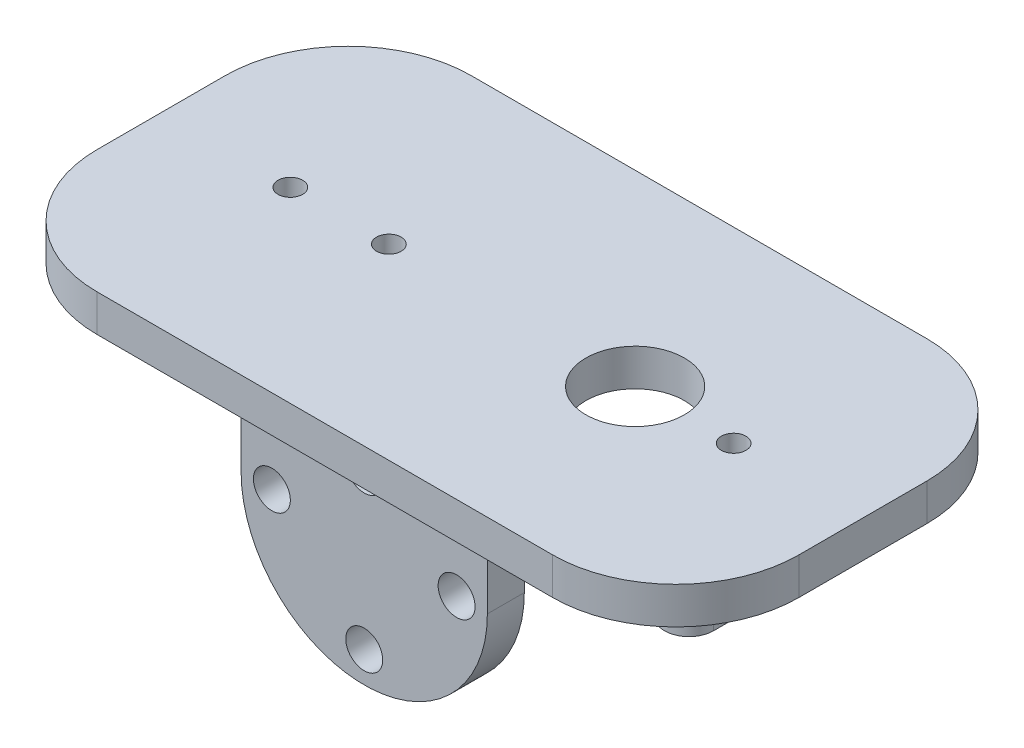
from build123d import *

# Parameters (mm, degrees)
SKETCH1_W                    = 57
SKETCH1_H                    = 30.4
BOSS_EXTRUDE1_DEPTH          = 3
BOSS_EXTRUDE2_DEPTH          = 7
BOSS_EXTRUDE3_DEPTH          = 3
BOSS_EXTRUDE4_DEPTH          = 7
F_8_0_8_DIAMETER_HOLE1_D     = 8
F_2_0_2_DIAMETER_HOLE1_D     = 2
F_2_0_2_DIAMETER_HOLE2_D     = 2
F_2_0_2_DIAMETER_HOLE2_DEPTH = 3
F_3_0_3_DIAMETER_HOLE1_D     = 3
F_3_0_3_DIAMETER_HOLE1_DEPTH = 6.2
F_3_0_3_DIAMETER_HOLE2_D     = 3
F_3_0_3_DIAMETER_HOLE2_DEPTH = 30.4
F_2_0_2_DIAMETER_HOLE3_D     = 2
F_2_0_2_DIAMETER_HOLE3_DEPTH = 5
FILLET1_R                    = 10


with BuildPart() as part:
    # Sketch1 → Boss-Extrude1 (new body)
    with BuildSketch(Plane.XZ):
        Rectangle(SKETCH1_W, SKETCH1_H)
    extrude(amount=-BOSS_EXTRUDE1_DEPTH)

    # Sketch2 → Boss-Extrude2 (add)
    with BuildSketch(Plane.XZ):
        with BuildLine():
            Line((16.37363234, -4), (16.37363234, 4))
            ThreePointArc((16.37363234, 4), (18.37363234, 6), (20.37363234, 4))
            Line((20.37363234, 4), (20.37363234, -4))
            ThreePointArc((20.37363234, -4), (18.37363234, -6), (16.37363234, -4))
        make_face()
    extrude(amount=BOSS_EXTRUDE2_DEPTH)

    # Sketch3 → Boss-Extrude3 (add)
    with BuildSketch(Plane.XY.offset(12)):
        with BuildLine():
            Line((10, -7), (10, 0))
            Line((10, 0), (-10, 0))
            Line((-10, 0), (-10, -7))
            ThreePointArc((-10, -7), (0, -17), (10, -7))
        make_face()
    extrude(amount=-BOSS_EXTRUDE3_DEPTH)

    # Sketch4 → Boss-Extrude4 (add)
    with BuildSketch(Plane.XZ):
        with BuildLine():
            Line((-11.12636766, -4), (-11.12636766, 4))
            ThreePointArc((-11.12636766, 4), (-9.12636766, 6), (-7.12636766, 4))
            Line((-7.12636766, 4), (-7.12636766, -4))
            ThreePointArc((-7.12636766, -4), (-9.12636766, -6), (-11.12636766, -4))
        make_face()
    extrude(amount=BOSS_EXTRUDE4_DEPTH)

    # Ø8.0 (8) Diameter Hole1 (through all)
    with Locations(Plane(origin=(0, 0, 0), x_dir=(-1, 0, 0), z_dir=(0, -1, 0))):
        with Locations((-10, 0)):
            Hole(F_8_0_8_DIAMETER_HOLE1_D / 2)

    # Ø2.0 (2) Diameter Hole1 (through all)
    with Locations(Plane(origin=(0, 0, 0), x_dir=(-1, 0, 0), z_dir=(0, -1, 0))):
        with Locations((18, 0)):
            Hole(F_2_0_2_DIAMETER_HOLE1_D / 2)

    # Ø2.0 (2) Diameter Hole2
    with Locations(Plane(origin=(0, 3, 0), x_dir=(1, 0, 0), z_dir=(0, 1, 0))):
        with Locations((18, 0), (-10, 0)):
            Hole(F_2_0_2_DIAMETER_HOLE2_D / 2, depth=F_2_0_2_DIAMETER_HOLE2_DEPTH)

    # Ø3.0 (3) Diameter Hole1
    with Locations(Plane.XY.offset(15.2)):
        with Locations((-7.5, -7)):
            Hole(F_3_0_3_DIAMETER_HOLE1_D / 2, depth=F_3_0_3_DIAMETER_HOLE1_DEPTH)

    # Ø3.0 (3) Diameter Hole2
    with Locations(Plane.XY.offset(15.2)):
        with Locations((0, -2), (7.5, -7), (0, -14.5)):
            Hole(F_3_0_3_DIAMETER_HOLE2_D / 2, depth=F_3_0_3_DIAMETER_HOLE2_DEPTH)

    # Ø2.0 (2) Diameter Hole3
    with Locations(Plane(origin=(0, -7, 0), x_dir=(-1, 0, 0), z_dir=(0, -1, 0))):
        with Locations((-18.749249064, -0.114633429), (9.24834794, 0.252193543)):
            Hole(F_2_0_2_DIAMETER_HOLE3_D / 2, depth=F_2_0_2_DIAMETER_HOLE3_DEPTH)

    # Fillet1
    fillet1_edges = [part.edges().sort_by_distance(p)[0] for p in [
        (-28.5, 1.5, -15.2),
        (28.5, 1.5, -15.2),
        (-28.5, 1.5, 15.2),
        (28.5, 1.5, 15.2),
    ]]
    fillet(fillet1_edges, radius=FILLET1_R)


with BuildPart() as body_2:
    # Split1: the piece on the far side of the plane
    add(part.part)
    split(bisect_by=Plane(origin=(0, 0, 0), x_dir=(0, 0, -1), z_dir=(0, -1, 0)), keep=Keep.BOTTOM)


with BuildPart() as part_1:
    add(part.part)

    # Split1
    split(bisect_by=Plane(origin=(0, 0, 0), x_dir=(0, 0, -1), z_dir=(0, -1, 0)), keep=Keep.TOP)


solid = Compound([body_2.part, part_1.part])
